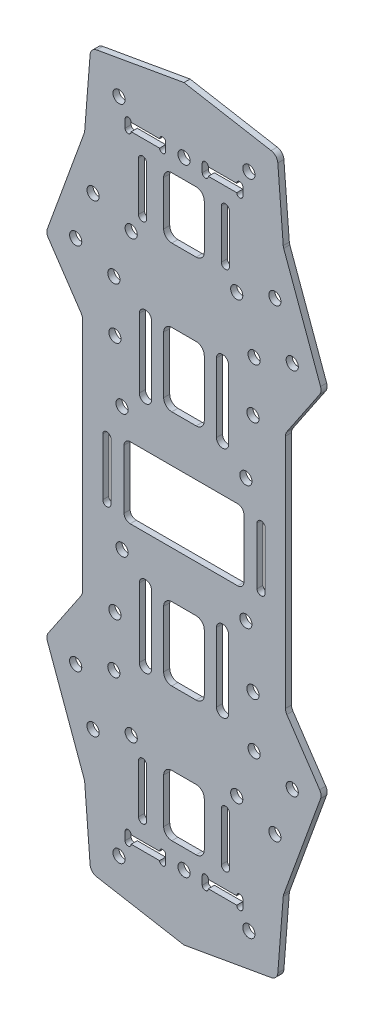
from build123d import *

# Parameters (mm, degrees)
SKETCH1_R          = 1.5
BOTTOM_PLATE_DEPTH = 1.5


with BuildPart() as part:
    # Sketch1 → bottom-plate (new body)
    with BuildSketch(Plane.XY):
        with BuildLine():
            Line((-24.571418021, 68.904816085), (-33.651464065, 43.95759461))
            ThreePointArc((-33.651464065, 43.95759461), (-33.757171127, 43.029815637), (-33.430153969, 42.155168516))
            Line((-33.430153969, 42.155168516), (-25.341924855, 30.163875727))
            ThreePointArc((-25.341924855, 30.163875727), (-25.087390488, 29.63023333), (-25, 29.04548992))
            Line((-25, 29.04548992), (-25, -29.04548992))
            ThreePointArc((-25, -29.04548992), (-25.087390488, -29.63023333), (-25.341924855, -30.163875727))
            Line((-25.341924855, -30.163875727), (-33.430153969, -42.155168516))
            ThreePointArc((-33.430153969, -42.155168516), (-33.757171127, -43.029815637), (-33.651464065, -43.95759461))
            Line((-33.651464065, -43.95759461), (-24.571418021, -68.904816085))
            ThreePointArc((-24.571418021, -68.904816085), (-24.49634105, -69.164501027), (-24.456968595, -69.43193818))
            Line((-24.456968595, -69.43193818), (-23.121499045, -86.400687699))
            ThreePointArc((-23.121499045, -86.400687699), (-22.608100633, -87.588503122), (-21.474960733, -88.213385013))
            Line((-21.474960733, -88.213385013), (0, -92))
            Line((0, -92), (21.474960733, -88.213385013))
            ThreePointArc((21.474960733, -88.213385013), (22.608100633, -87.588503122), (23.121499045, -86.400687699))
            Line((23.121499045, -86.400687699), (24.456968595, -69.43193818))
            ThreePointArc((24.456968595, -69.43193818), (24.49634105, -69.164501027), (24.571418021, -68.904816085))
            Line((24.571418021, -68.904816085), (33.651464065, -43.95759461))
            ThreePointArc((33.651464065, -43.95759461), (33.757171127, -43.029815637), (33.430153969, -42.155168516))
            Line((33.430153969, -42.155168516), (25.341924855, -30.163875727))
            ThreePointArc((25.341924855, -30.163875727), (25.087390488, -29.63023333), (25, -29.04548992))
            Line((25, -29.04548992), (25, 29.04548992))
            ThreePointArc((25, 29.04548992), (25.087390488, 29.63023333), (25.341924855, 30.163875727))
            Line((25.341924855, 30.163875727), (33.430153969, 42.155168516))
            ThreePointArc((33.430153969, 42.155168516), (33.757171127, 43.029815637), (33.651464065, 43.95759461))
            Line((33.651464065, 43.95759461), (24.571418021, 68.904816085))
            ThreePointArc((24.571418021, 68.904816085), (24.49634105, 69.164501027), (24.456968595, 69.43193818))
            Line((24.456968595, 69.43193818), (23.121499045, 86.400687699))
            ThreePointArc((23.121499045, 86.400687699), (22.608100633, 87.588503122), (21.474960733, 88.213385013))
            Line((21.474960733, 88.213385013), (0, 92))
            Line((0, 92), (-21.474960733, 88.213385013))
            ThreePointArc((-21.474960733, 88.213385013), (-22.608100633, 87.588503122), (-23.121499045, 86.400687699))
            Line((-23.121499045, 86.400687699), (-24.456968595, 69.43193818))
            ThreePointArc((-24.456968595, 69.43193818), (-24.49634105, 69.164501027), (-24.571418021, 68.904816085))
        make_face()
        with Locations((-16, 81)):
            Circle(SKETCH1_R, mode=Mode.SUBTRACT)
        with Locations((0, 76)):
            Circle(SKETCH1_R, mode=Mode.SUBTRACT)
        with Locations((-26.672177999, 45.420201433)):
            Circle(SKETCH1_R, mode=Mode.SUBTRACT)
        with Locations((-22.396926208, 57.166359193)):
            Circle(SKETCH1_R, mode=Mode.SUBTRACT)
        with Locations((-17.275251792, 42)):
            Circle(SKETCH1_R, mode=Mode.SUBTRACT)
        with Locations((-13, 53.74615776)):
            Circle(SKETCH1_R, mode=Mode.SUBTRACT)
        with Locations((-17, 29.5)):
            Circle(SKETCH1_R, mode=Mode.SUBTRACT)
        with Locations((-15.25, 15.25)):
            Circle(SKETCH1_R, mode=Mode.SUBTRACT)
        with Locations((15.25, 15.25)):
            Circle(SKETCH1_R, mode=Mode.SUBTRACT)
        with Locations((17, 29.5)):
            Circle(SKETCH1_R, mode=Mode.SUBTRACT)
        with Locations((13, 53.74615776)):
            Circle(SKETCH1_R, mode=Mode.SUBTRACT)
        with Locations((17.275251792, 42)):
            Circle(SKETCH1_R, mode=Mode.SUBTRACT)
        with Locations((22.396926208, 57.166359193)):
            Circle(SKETCH1_R, mode=Mode.SUBTRACT)
        with Locations((26.672177999, 45.420201433)):
            Circle(SKETCH1_R, mode=Mode.SUBTRACT)
        with Locations((16, 81)):
            Circle(SKETCH1_R, mode=Mode.SUBTRACT)
        with Locations((16, -81)):
            Circle(SKETCH1_R, mode=Mode.SUBTRACT)
        with Locations((26.672177999, -45.420201433)):
            Circle(SKETCH1_R, mode=Mode.SUBTRACT)
        with Locations((22.396926208, -57.166359193)):
            Circle(SKETCH1_R, mode=Mode.SUBTRACT)
        with Locations((17.275251792, -42)):
            Circle(SKETCH1_R, mode=Mode.SUBTRACT)
        with Locations((13, -53.74615776)):
            Circle(SKETCH1_R, mode=Mode.SUBTRACT)
        with Locations((17, -29.5)):
            Circle(SKETCH1_R, mode=Mode.SUBTRACT)
        with Locations((15.25, -15.25)):
            Circle(SKETCH1_R, mode=Mode.SUBTRACT)
        with Locations((-15.25, -15.25)):
            Circle(SKETCH1_R, mode=Mode.SUBTRACT)
        with Locations((-17, -29.5)):
            Circle(SKETCH1_R, mode=Mode.SUBTRACT)
        with Locations((-13, -53.74615776)):
            Circle(SKETCH1_R, mode=Mode.SUBTRACT)
        with Locations((-17.275251792, -42)):
            Circle(SKETCH1_R, mode=Mode.SUBTRACT)
        with Locations((-22.396926208, -57.166359193)):
            Circle(SKETCH1_R, mode=Mode.SUBTRACT)
        with Locations((-26.672177999, -45.420201433)):
            Circle(SKETCH1_R, mode=Mode.SUBTRACT)
        with Locations((0, -76)):
            Circle(SKETCH1_R, mode=Mode.SUBTRACT)
        with Locations((-16, -81)):
            Circle(SKETCH1_R, mode=Mode.SUBTRACT)
        with BuildLine():
            Line((20, 7), (20, -7))
            ThreePointArc((20, -7), (19, -8), (18, -7))
            Line((18, -7), (18, 7))
            ThreePointArc((18, 7), (19, 8), (20, 7))
        make_face(mode=Mode.SUBTRACT)
        with BuildLine():
            Line((-18, 7), (-18, -7))
            ThreePointArc((-18, -7), (-19, -8), (-20, -7))
            Line((-20, -7), (-20, 7))
            ThreePointArc((-20, 7), (-19, 8), (-18, 7))
        make_face(mode=Mode.SUBTRACT)
        with BuildLine():
            Line((-11.2, -70.25), (-11.2, -58.25))
            ThreePointArc((-11.2, -58.25), (-10.2, -57.25), (-9.2, -58.25))
            Line((-9.2, -58.25), (-9.2, -70.25))
            ThreePointArc((-9.2, -70.25), (-10.2, -71.25), (-11.2, -70.25))
        make_face(mode=Mode.SUBTRACT)
        with BuildLine():
            Line((-11, -37.25), (-11, -20.25))
            ThreePointArc((-11, -20.25), (-9.5, -18.75), (-8, -20.25))
            Line((-8, -20.25), (-8, -37.25))
            ThreePointArc((-8, -37.25), (-9.5, -38.75), (-11, -37.25))
        make_face(mode=Mode.SUBTRACT)
        with BuildLine():
            Line((8, -37.25), (8, -20.25))
            ThreePointArc((8, -20.25), (9.5, -18.75), (11, -20.25))
            Line((11, -20.25), (11, -37.25))
            ThreePointArc((11, -37.25), (9.5, -38.75), (8, -37.25))
        make_face(mode=Mode.SUBTRACT)
        with BuildLine():
            Line((9.2, -70.25), (9.2, -58.25))
            ThreePointArc((9.2, -58.25), (10.2, -57.25), (11.2, -58.25))
            Line((11.2, -58.25), (11.2, -70.25))
            ThreePointArc((11.2, -70.25), (10.2, -71.25), (9.2, -70.25))
        make_face(mode=Mode.SUBTRACT)
        with BuildLine():
            Line((-3, -20.25), (3, -20.25))
            ThreePointArc((3, -20.25), (4.414213562, -20.835786438), (5, -22.25))
            Line((5, -22.25), (5, -36.25))
            ThreePointArc((5, -36.25), (4.414213562, -37.664213562), (3, -38.25))
            Line((3, -38.25), (-3, -38.25))
            ThreePointArc((-3, -38.25), (-4.414213562, -37.664213562), (-5, -36.25))
            Line((-5, -36.25), (-5, -22.25))
            ThreePointArc((-5, -22.25), (-4.414213562, -20.835786438), (-3, -20.25))
        make_face(mode=Mode.SUBTRACT)
        with BuildLine():
            Line((5, -58.25), (5, -69.25))
            ThreePointArc((5, -69.25), (4.414213562, -70.664213562), (3, -71.25))
            Line((3, -71.25), (-3, -71.25))
            ThreePointArc((-3, -71.25), (-4.414213562, -70.664213562), (-5, -69.25))
            Line((-5, -69.25), (-5, -58.25))
            ThreePointArc((-5, -58.25), (-4.414213562, -56.835786438), (-3, -56.25))
            Line((-3, -56.25), (3, -56.25))
            ThreePointArc((3, -56.25), (4.414213562, -56.835786438), (5, -58.25))
        make_face(mode=Mode.SUBTRACT)
        with BuildLine():
            Line((11.2, 70.25), (11.2, 58.25))
            ThreePointArc((11.2, 58.25), (10.2, 57.25), (9.2, 58.25))
            Line((9.2, 58.25), (9.2, 70.25))
            ThreePointArc((9.2, 70.25), (10.2, 71.25), (11.2, 70.25))
        make_face(mode=Mode.SUBTRACT)
        with BuildLine():
            Line((11, 37.25), (11, 20.25))
            ThreePointArc((11, 20.25), (9.5, 18.75), (8, 20.25))
            Line((8, 20.25), (8, 37.25))
            ThreePointArc((8, 37.25), (9.5, 38.75), (11, 37.25))
        make_face(mode=Mode.SUBTRACT)
        with BuildLine():
            Line((-8, 37.25), (-8, 20.25))
            ThreePointArc((-8, 20.25), (-9.5, 18.75), (-11, 20.25))
            Line((-11, 20.25), (-11, 37.25))
            ThreePointArc((-11, 37.25), (-9.5, 38.75), (-8, 37.25))
        make_face(mode=Mode.SUBTRACT)
        with BuildLine():
            Line((-9.2, 70.25), (-9.2, 58.25))
            ThreePointArc((-9.2, 58.25), (-10.2, 57.25), (-11.2, 58.25))
            Line((-11.2, 58.25), (-11.2, 70.25))
            ThreePointArc((-11.2, 70.25), (-10.2, 71.25), (-9.2, 70.25))
        make_face(mode=Mode.SUBTRACT)
        with BuildLine():
            Line((13.25, -8.75), (-13.25, -8.75))
            ThreePointArc((-13.25, -8.75), (-14.310660172, -8.310660172), (-14.75, -7.25))
            Line((-14.75, -7.25), (-14.75, 7.25))
            ThreePointArc((-14.75, 7.25), (-14.310660172, 8.310660172), (-13.25, 8.75))
            Line((-13.25, 8.75), (13.25, 8.75))
            ThreePointArc((13.25, 8.75), (14.310660172, 8.310660172), (14.75, 7.25))
            Line((14.75, 7.25), (14.75, -7.25))
            ThreePointArc((14.75, -7.25), (14.310660172, -8.310660172), (13.25, -8.75))
        make_face(mode=Mode.SUBTRACT)
        with BuildLine():
            Line((-5, 58.25), (-5, 69.25))
            ThreePointArc((-5, 69.25), (-4.414213562, 70.664213562), (-3, 71.25))
            Line((-3, 71.25), (3, 71.25))
            ThreePointArc((3, 71.25), (4.414213562, 70.664213562), (5, 69.25))
            Line((5, 69.25), (5, 58.25))
            ThreePointArc((5, 58.25), (4.414213562, 56.835786438), (3, 56.25))
            Line((3, 56.25), (-3, 56.25))
            ThreePointArc((-3, 56.25), (-4.414213562, 56.835786438), (-5, 58.25))
        make_face(mode=Mode.SUBTRACT)
        with BuildLine():
            Line((-3, 38.25), (3, 38.25))
            ThreePointArc((3, 38.25), (4.414213562, 37.664213562), (5, 36.25))
            Line((5, 36.25), (5, 22.25))
            ThreePointArc((5, 22.25), (4.414213562, 20.835786438), (3, 20.25))
            Line((3, 20.25), (-3, 20.25))
            ThreePointArc((-3, 20.25), (-4.414213562, 20.835786438), (-5, 22.25))
            Line((-5, 22.25), (-5, 36.25))
            ThreePointArc((-5, 36.25), (-4.414213562, 37.664213562), (-3, 38.25))
        make_face(mode=Mode.SUBTRACT)
        with BuildLine():
            Line((-14.5, 75), (-14.5, 77))
            ThreePointArc((-14.5, 77), (-13.75, 77.75), (-13, 77))
            Line((-13, 77), (-6, 77))
            ThreePointArc((-6, 77), (-5.25, 77.75), (-4.5, 77))
            Line((-4.5, 77), (-4.5, 75))
            ThreePointArc((-4.5, 75), (-5.25, 74.25), (-6, 75))
            Line((-6, 75), (-13, 75))
            ThreePointArc((-13, 75), (-13.75, 74.25), (-14.5, 75))
        make_face(mode=Mode.SUBTRACT)
        with BuildLine():
            Line((6, 77), (13, 77))
            ThreePointArc((13, 77), (13.75, 77.75), (14.5, 77))
            Line((14.5, 77), (14.5, 75))
            ThreePointArc((14.5, 75), (13.75, 74.25), (13, 75))
            Line((13, 75), (6, 75))
            ThreePointArc((6, 75), (5.25, 74.25), (4.5, 75))
            Line((4.5, 75), (4.5, 77))
            ThreePointArc((4.5, 77), (5.25, 77.75), (6, 77))
        make_face(mode=Mode.SUBTRACT)
        with BuildLine():
            Line((13, -77), (6, -77))
            ThreePointArc((6, -77), (5.25, -77.75), (4.5, -77))
            Line((4.5, -77), (4.5, -75))
            ThreePointArc((4.5, -75), (5.25, -74.25), (6, -75))
            Line((6, -75), (13, -75))
            ThreePointArc((13, -75), (13.75, -74.25), (14.5, -75))
            Line((14.5, -75), (14.5, -77))
            ThreePointArc((14.5, -77), (13.75, -77.75), (13, -77))
        make_face(mode=Mode.SUBTRACT)
        with BuildLine():
            Line((-6, -77), (-13, -77))
            ThreePointArc((-13, -77), (-13.75, -77.75), (-14.5, -77))
            Line((-14.5, -77), (-14.5, -75))
            ThreePointArc((-14.5, -75), (-13.75, -74.25), (-13, -75))
            Line((-13, -75), (-6, -75))
            ThreePointArc((-6, -75), (-5.25, -74.25), (-4.5, -75))
            Line((-4.5, -75), (-4.5, -77))
            ThreePointArc((-4.5, -77), (-5.25, -77.75), (-6, -77))
        make_face(mode=Mode.SUBTRACT)
    extrude(amount=-BOTTOM_PLATE_DEPTH)


solid = part.part
